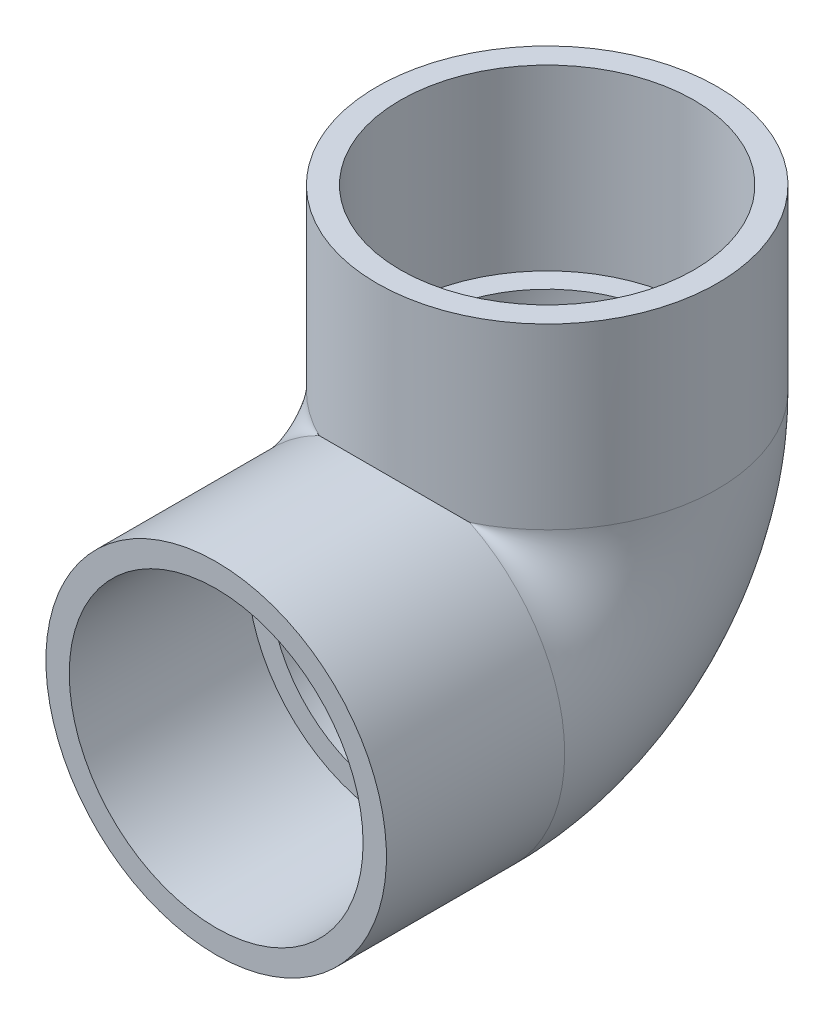
from build123d import *

# Parameters (mm, degrees)
SKETCH2_W        = 44.45
SKETCH2_H        = 5.826125
SKETCH3_W        = 5.826125
SKETCH3_H        = 44.45
SWEEP1_OUTLINE_R = 31.0515
SWEEP1_ANGLE     = 90


# Read off the part's stored shape, not the designer's step: Sweep1
with BuildPart() as part:
    # Sketch2 → Revolve1 (revolve)
    with BuildSketch(Plane(origin=(0, 0, 0), x_dir=(0, 0, -1), z_dir=(1, 0, 0))):
        with Locations((-60.325, 39.5525625)):
            Rectangle(SKETCH2_W, SKETCH2_H)
    revolve(axis=Axis((0, 0, 0), (0, 0, 1)))

    # Sketch3 → Revolve2 (revolve)
    with BuildSketch(Plane(origin=(0, 0, 0), x_dir=(0, 0, -1), z_dir=(1, 0, 0))):
        with Locations((39.5525625, 60.325)):
            Rectangle(SKETCH3_W, SKETCH3_H)
    revolve(axis=Axis((0, 0, 0), (0, 1, 0)))

    # Sweep1 outline → Sweep1 (revolve)
    with BuildSketch(Plane(origin=(0, 38.1, 38.1), x_dir=(0, -1, 0), z_dir=(0, 0, 1))):
        with BuildLine():
            Line((0, 18.754181044), (0, -18.754181044))
            add(Edge.make_bspline(
                [(0, -18.754181044), (3.595121657, -26.057839615), (9.397449748, -33.407976072), (17.825883125, -39.559399853), (28.204619336, -42.465624968), (44.310790561, -42.46562502), (50.403307493, -41.329592494), (55.932569526, -39.150372881), (60.686650624, -36.321869277), (69.83985958, -28.979313764), (74.693549795, -23.427727825), (78.605101985, -16.344282836), (82.51560631, -3.11e-07), (78.605102252, 16.34428235), (74.693550018, 23.42772757), (69.839859698, 28.979313669), (60.686650629, 36.321869273), (55.932569539, 39.150372874), (50.403307515, 41.329592485), (44.310790594, 42.465625014), (28.204619371, 42.465624978), (17.825883146, 39.559399869), (9.397449758, 33.407976085), (3.59512166, 26.057839621), (0, 18.754181044)],
                knots=[3.599009571, 3.599009571, 3.599009571, 3.599009571, 3.599009571, 3.599009571, 4.698420057, 4.698420057, 4.698420057, 4.698420057, 5.388460062, 5.388460062, 5.388460062, 5.388460062, 6.283185297, 6.283185297, 6.283185297, 7.177910553, 7.177910553, 7.177910553, 7.177910553, 7.867950556, 7.867950556, 7.867950556, 7.867950556, 8.967361044, 8.967361044, 8.967361044, 8.967361044, 8.967361044, 8.967361044], degree=5, weights=[1, 1, 0.995343828, 0.991763785, 1, 1, 0.999483219, 0.999983206, 1, 1, 0.998916664, 0.997304294, 1.002695707, 0.997304293, 0.998916664, 1, 1, 0.999983206, 0.999483219, 1, 1, 0.991763785, 0.995343828, 1, 1]))
        make_face()
        with Locations((38.1, 0)):
            Circle(SWEEP1_OUTLINE_R, mode=Mode.SUBTRACT)
    revolve(axis=Axis((0, 38.1, 38.1), (1, 0, 0)), revolution_arc=SWEEP1_ANGLE)


solid = part.part
